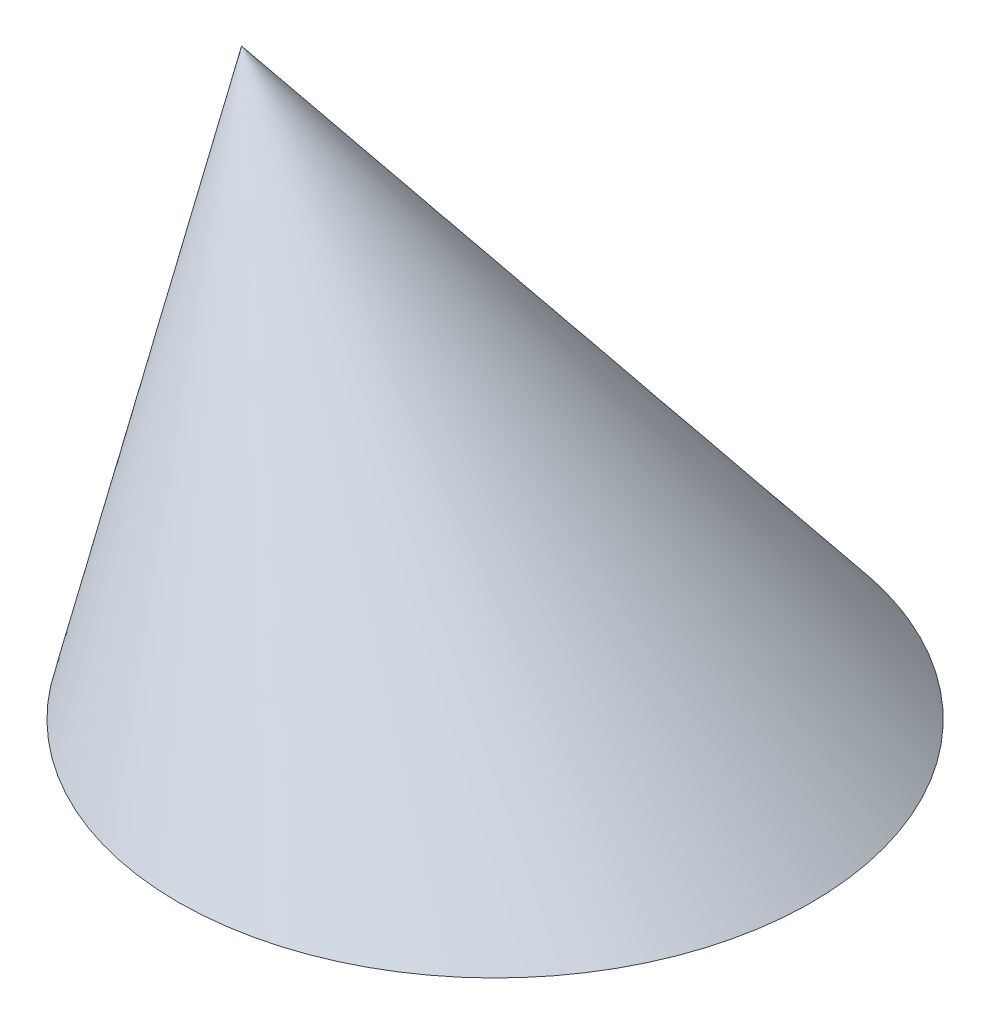
from build123d import *

# Parameters (mm, degrees)
SKETCH_1_R = 250


with BuildPart() as part:
    # 草图1 → 放样1 section 0
    with BuildSketch(Plane(origin=(0, 0, 0), x_dir=(1, 0, 0), z_dir=(0, 1, 0)), mode=Mode.PRIVATE) as loft_1_s0:
        Circle(SKETCH_1_R)
    loft([loft_1_s0.sketch, Vertex(-200, 360, 0)])


solid = part.part
